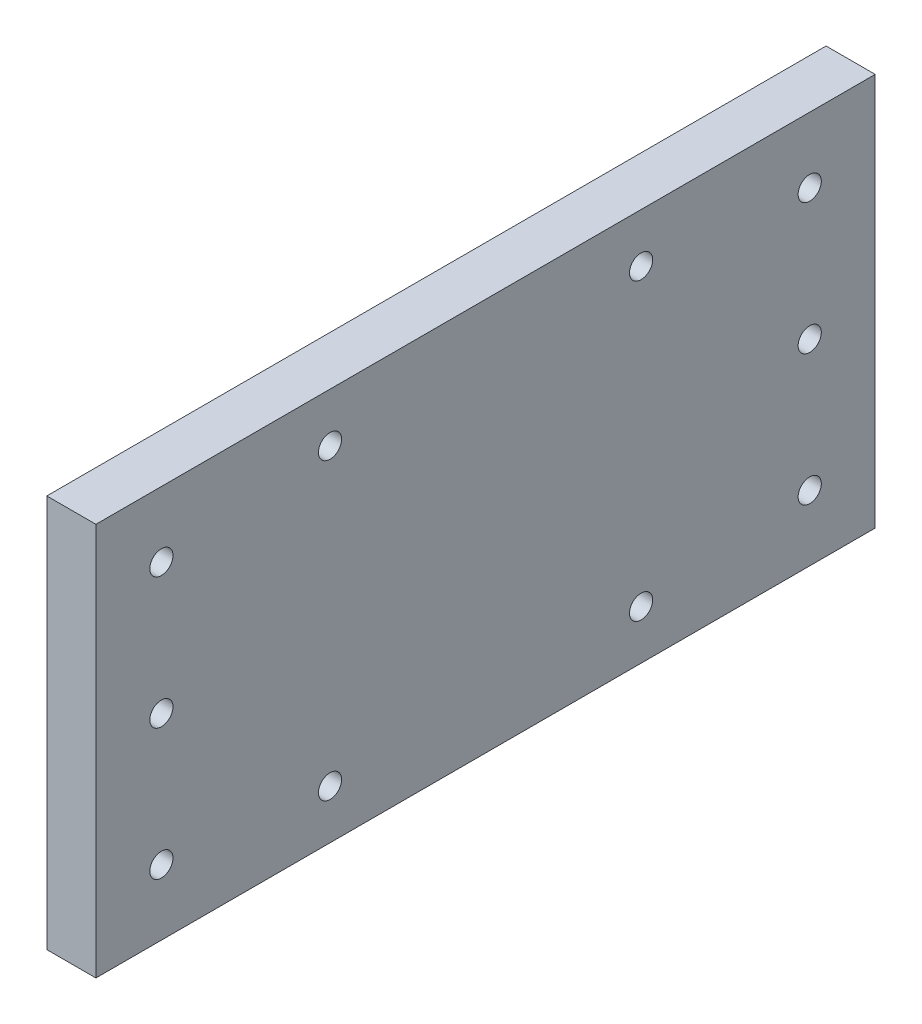
from build123d import *

# Parameters (mm, degrees)
SKETCH1_W             = 9.525
SKETCH1_H             = 76.2
BOSS_EXTRUDE1_DEPTH   = 151.13
F_8_CLEARANCE_HOLE1_D = 4.4958
F_8_CLEARANCE_HOLE2_D = 4.4958


with BuildPart() as part:
    # Sketch1 → Boss-Extrude1 (new body)
    with BuildSketch(Plane.XY):
        Rectangle(SKETCH1_W, SKETCH1_H)
    extrude(amount=BOSS_EXTRUDE1_DEPTH)

    # #8 Clearance Hole1 (through all)
    with Locations(Plane(origin=(4.7625, 0, 0), x_dir=(0, 0, -1), z_dir=(1, 0, 0))):
        with Locations((-45.4025, -28.575), (-105.7275, 28.575), (-105.7275, -28.575), (-45.4025, 28.575)):
            Hole(F_8_CLEARANCE_HOLE1_D / 2)

    # #8 Clearance Hole2 (through all)
    with Locations(Plane(origin=(4.7625, 0, 0), x_dir=(0, 0, -1), z_dir=(1, 0, 0))):
        with Locations((-138.43, 25.4), (-138.43, 0), (-138.43, -25.4), (-12.7, 25.4), (-12.7, 0), (-12.7, -25.4)):
            Hole(F_8_CLEARANCE_HOLE2_D / 2)


solid = part.part
